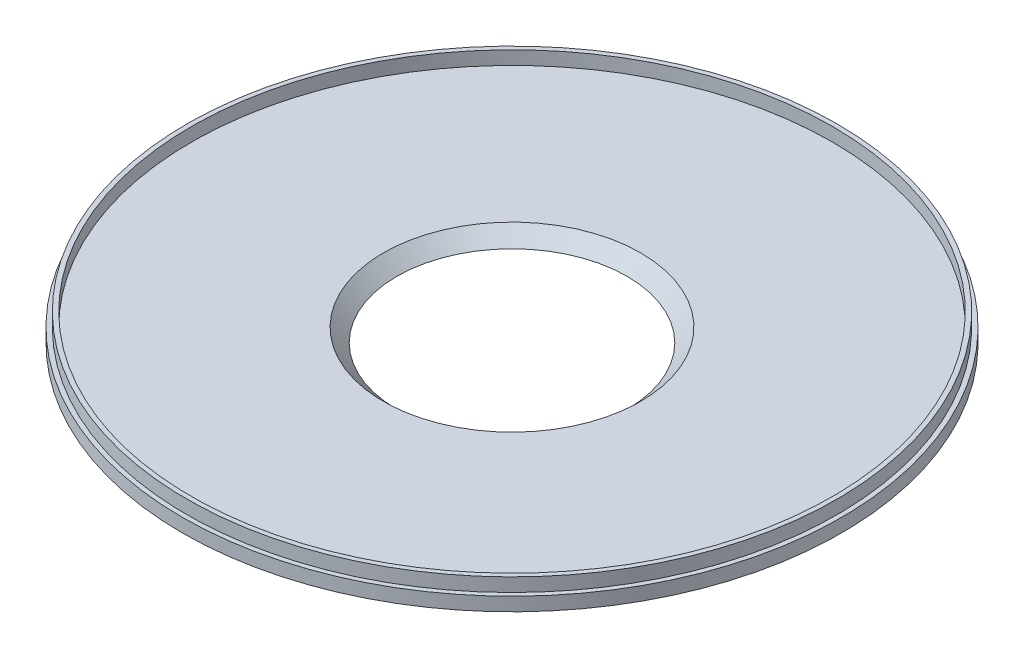
from build123d import *

# Parameters (mm, degrees)
SMUSSO1_SIZE = 3


with BuildPart() as part:
    # Schizzo1 → Rivoluzione1 (revolve)
    with BuildSketch(Plane.XY, mode=Mode.PRIVATE) as rivoluzione1_sk:
        Polygon((-25.5, 0), (-25.5, 3), (-71, 3), (-71, 6), (-72, 6), (-72, 3), (-73, 3), (-73, 0), align=None)
    revolve(rivoluzione1_sk.sketch.rotate(Axis((0, 0, 0), (0, 1, 0)), 270), axis=Axis((0, 0, 0), (0, 1, 0)))

    # Smusso1
    smusso1_edges = [part.edges().sort_by_distance(p)[0] for p in [
        (0, 3, 25.5),
    ]]
    chamfer(smusso1_edges, length=SMUSSO1_SIZE - 0.0001)  # a hair under: the kernel refuses the full size


solid = part.part
